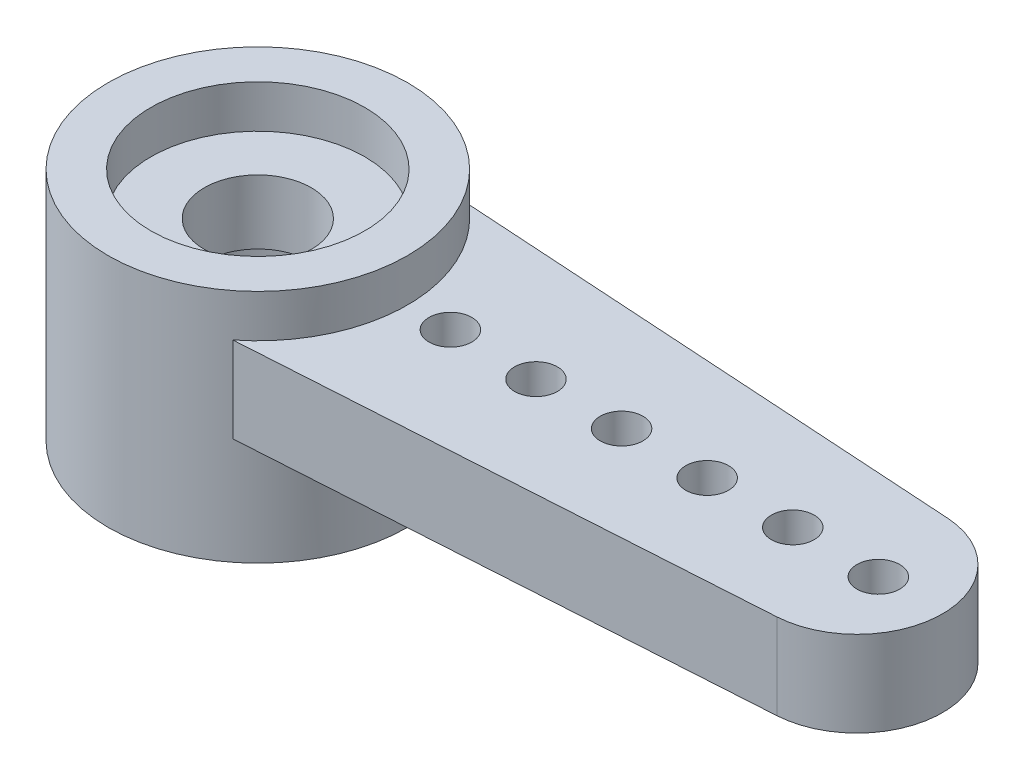
from build123d import *

# Parameters (mm, degrees)
SKETCH1_R           = 3.5
BOSS_EXTRUDE1_DEPTH = 5.5
SKETCH2_R           = 2.5
CUT_EXTRUDE1_DEPTH  = 1
CUT_EXTRUDE2_START  = -3
SKETCH3_R           = 2.5
CUT_EXTRUDE2_DEPTH  = 3
SKETCH4_R           = 1.25
CUT_EXTRUDE3_DEPTH  = 7.68954408
BOSS_EXTRUDE2_START = -2
BOSS_EXTRUDE2_DEPTH = 2
SKETCH6_R           = 0.5
CUT_EXTRUDE4_DEPTH  = 17.985287751


with BuildPart() as part:
    # Sketch1 → Boss-Extrude1 (new body)
    with BuildSketch(Plane(origin=(0, 0, 0), x_dir=(1, 0, 0), z_dir=(0, 1, 0))):
        Circle(SKETCH1_R)
    extrude(amount=BOSS_EXTRUDE1_DEPTH)

    # Sketch2 → Cut-Extrude1 (cut)
    with BuildSketch(Plane(origin=(0, 5.5, 0), x_dir=(1, 0, 0), z_dir=(0, 1, 0))):
        Circle(SKETCH2_R)
    extrude(amount=-CUT_EXTRUDE1_DEPTH, mode=Mode.SUBTRACT)

    # Sketch3 → Cut-Extrude2 (cut)
    with BuildSketch(Plane.XZ.offset(CUT_EXTRUDE2_START)):
        Circle(SKETCH3_R)
    extrude(amount=CUT_EXTRUDE2_DEPTH, mode=Mode.SUBTRACT)

    # Sketch4 → Cut-Extrude3 (cut, through all)
    with BuildSketch(Plane(origin=(0, 4.5, 0), x_dir=(1, 0, 0), z_dir=(0, 1, 0))):
        Circle(SKETCH4_R)
    extrude(amount=-CUT_EXTRUDE3_DEPTH, mode=Mode.SUBTRACT)

    # Sketch5 → Boss-Extrude2 (add)
    with BuildSketch(Plane(origin=(0, 4.5, 0), x_dir=(1, 0, 0), z_dir=(0, 1, 0)).offset(BOSS_EXTRUDE2_START)):
        with BuildLine():
            Line((2.165063509, 2.75), (14.125822824, 1.99603823))
            ThreePointArc((14.125822824, 1.99603823), (16, 0), (14.125822824, -1.99603823))
            Line((14.125822824, -1.99603823), (2.165063509, -2.75))
            ThreePointArc((2.165063509, -2.75), (3.5, 0), (2.165063509, 2.75))
        make_face()
    extrude(amount=BOSS_EXTRUDE2_DEPTH)

    # Sketch6 → Cut-Extrude4 (cut, through all)
    with BuildSketch(Plane(origin=(0, 4.5, 0), x_dir=(1, 0, 0), z_dir=(0, 1, 0))):
        with Locations((4.5, 0)):
            Circle(SKETCH6_R)
        with Locations((6.5, 0)):
            Circle(SKETCH6_R)
        with Locations((8.5, 0)):
            Circle(SKETCH6_R)
        with Locations((10.5, 0)):
            Circle(SKETCH6_R)
        with Locations((12.5, 0)):
            Circle(SKETCH6_R)
        with Locations((14.5, 0)):
            Circle(SKETCH6_R)
    extrude(amount=-CUT_EXTRUDE4_DEPTH, mode=Mode.SUBTRACT)


solid = part.part
